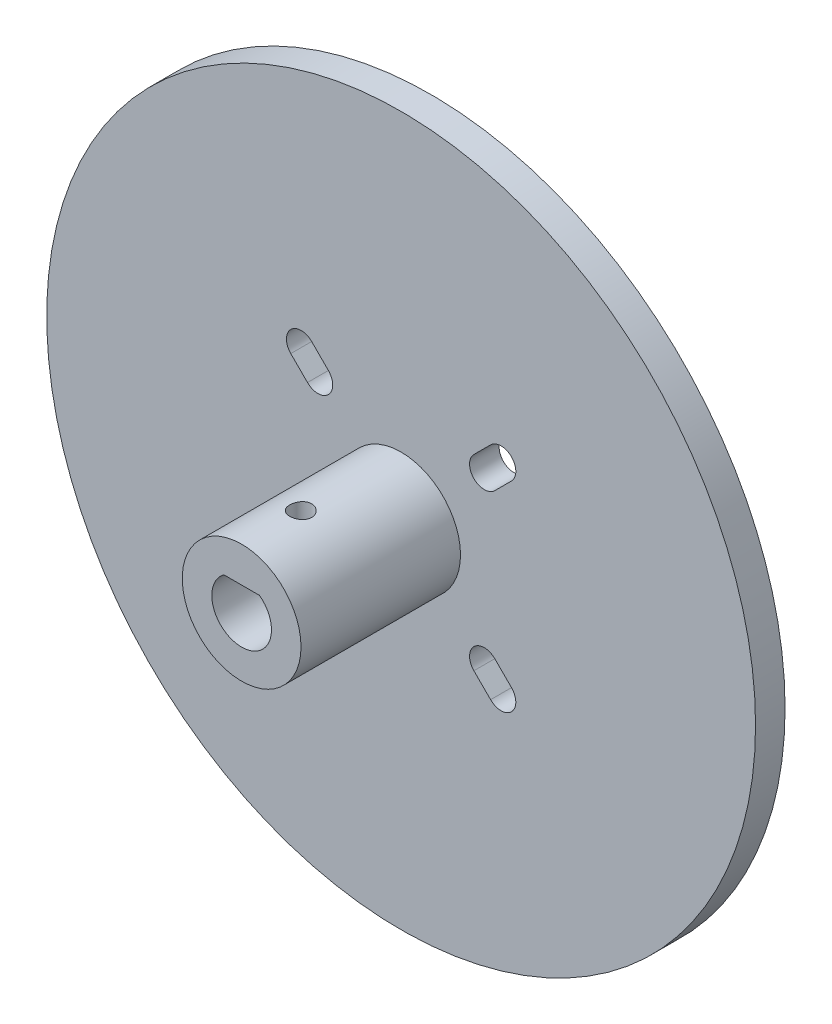
from build123d import *

# Parameters (mm, degrees)
SKETCH1_R               = 60
BOSS_EXTRUDE1_DEPTH     = 5
SKETCH2_R               = 10.05
BOSS_EXTRUDE2_DEPTH     = 27
CUT_EXTRUDE1_DEPTH      = 20
CUT_EXTRUDE1_DEPTH_BACK = 20
SKETCH3_R               = 1.85


with BuildPart() as part:
    # Sketch1 → Boss-Extrude1 (new body)
    with BuildSketch(Plane.XY):
        Circle(SKETCH1_R)
        with BuildLine():
            Line((-15.853553391, 12.318019485), (-18.681980515, 15.146446609))
            ThreePointArc((-18.681980515, 15.146446609), (-18.681980515, 18.681980515), (-15.146446609, 18.681980515))
            Line((-15.146446609, 18.681980515), (-12.318019485, 15.853553391))
            ThreePointArc((-12.318019485, 15.853553391), (-12.318019485, 12.318019485), (-15.853553391, 12.318019485))
        make_face(mode=Mode.SUBTRACT)
        with BuildLine():
            Line((15.853553391, 12.318019485), (18.681980515, 15.146446609))
            ThreePointArc((18.681980515, 15.146446609), (18.681980515, 18.681980515), (15.146446609, 18.681980515))
            Line((15.146446609, 18.681980515), (12.318019485, 15.853553391))
            ThreePointArc((12.318019485, 15.853553391), (12.318019485, 12.318019485), (15.853553391, 12.318019485))
        make_face(mode=Mode.SUBTRACT)
        with BuildLine():
            Line((12.318019485, -15.853553391), (15.146446609, -18.681980515))
            ThreePointArc((15.146446609, -18.681980515), (18.681980515, -18.681980515), (18.681980515, -15.146446609))
            Line((18.681980515, -15.146446609), (15.853553391, -12.318019485))
            ThreePointArc((15.853553391, -12.318019485), (12.318019485, -12.318019485), (12.318019485, -15.853553391))
        make_face(mode=Mode.SUBTRACT)
        with BuildLine():
            Line((-15.853553391, -12.318019485), (-18.681980515, -15.146446609))
            ThreePointArc((-18.681980515, -15.146446609), (-18.681980515, -18.681980515), (-15.146446609, -18.681980515))
            Line((-15.146446609, -18.681980515), (-12.318019485, -15.853553391))
            ThreePointArc((-12.318019485, -15.853553391), (-12.318019485, -12.318019485), (-15.853553391, -12.318019485))
        make_face(mode=Mode.SUBTRACT)
    extrude(amount=BOSS_EXTRUDE1_DEPTH)

    # Sketch2 → Boss-Extrude2 (add)
    with BuildSketch(Plane.XY.offset(5)):
        Circle(SKETCH2_R)
        with BuildLine():
            ThreePointArc((3.016620626, 4.05), (0, -5.05), (-3.016620626, 4.05))
            Line((-3.016620626, 4.05), (3.016620626, 4.05))
        make_face(mode=Mode.SUBTRACT)
    extrude(amount=BOSS_EXTRUDE2_DEPTH)

    # Sketch3 → Cut-Extrude1 (cut, two sides: drawn at the far end of the back side and taken through both)
    with BuildSketch(Plane(origin=(0, 4.05, 0), x_dir=(-1, 0, 0), z_dir=(0, -1, 0)).offset(-CUT_EXTRUDE1_DEPTH_BACK)):
        with Locations((0, -22)):
            Circle(SKETCH3_R)
    extrude(amount=CUT_EXTRUDE1_DEPTH + CUT_EXTRUDE1_DEPTH_BACK, mode=Mode.SUBTRACT)


solid = part.part
